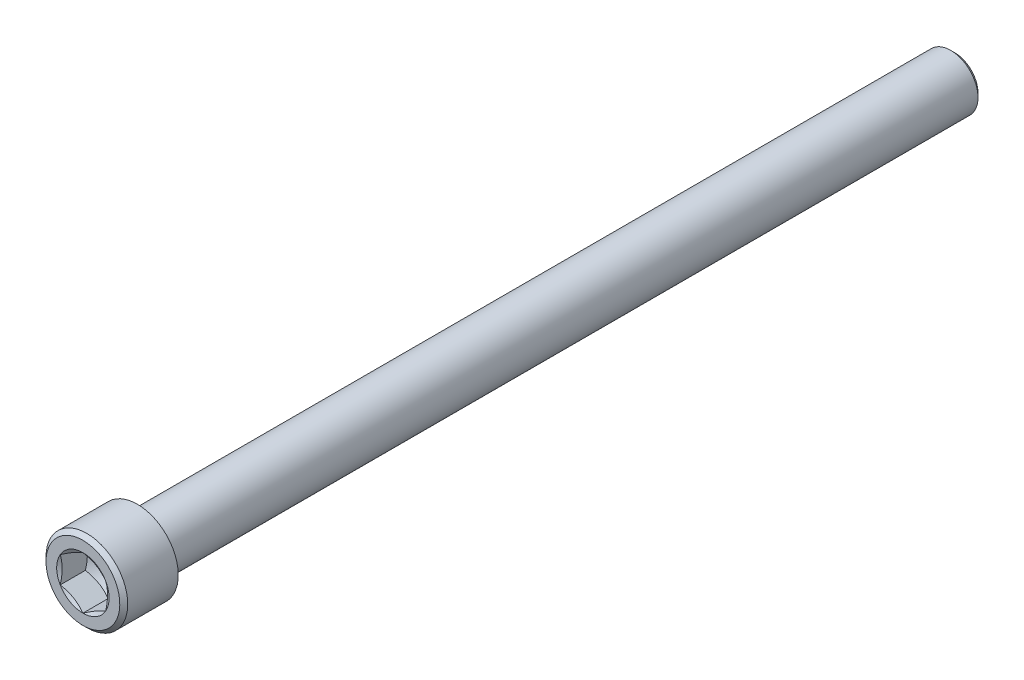
from build123d import *

# Parameters (mm, degrees)
CHAMFER1_SIZE      = 0.875
CUT_EXTRUDE1_REACH = 194.421
FILLET2_R          = 0.6


with BuildPart() as part:
    # Sketch1 → Revolve1 (revolve)
    with BuildSketch(Plane(origin=(0, 0, 0), x_dir=(0, 0, -1), z_dir=(1, 0, 0))):
        Polygon((0, 9), (-12, 9), (-12, 0), (180, 0), (180, 6), (0, 6), align=None)
    revolve(axis=Axis((0, 0, 12), (0, 0, -1)))

    # Sketch7 → Cut-Revolve2 (revolve, cut)
    with BuildSketch(Plane(origin=(0, 0, 0), x_dir=(0, 0, -1), z_dir=(1, 0, 0))):
        Polygon((-12, 0), (-12, 5), (-6, 5), (-3.113248654, 0), align=None)
    revolve(axis=Axis((0, 0, 12), (0, 0, -1)), mode=Mode.SUBTRACT)

    # Chamfer1
    chamfer1_edges = [part.edges().sort_by_distance(p)[0] for p in [
        (0, -6, -180),
        (0, -9, 12),
    ]]
    chamfer(chamfer1_edges, length=CHAMFER1_SIZE)

    # Cut-Extrude1: up to this cone (the profile starts inside it)
    cut_extrude1_end = Plane(origin=(0, 0, 12), z_dir=(0, 0, 1)).offset(-8.886750346) * Cone(1.732e-06, 379.665634345, 219.200055191, align=(Align.CENTER, Align.CENTER, Align.MIN), mode=Mode.PRIVATE)
    # Sketch8 → Cut-Extrude1 (cut, up to the surface)
    with BuildSketch(Plane.XY.offset(12), mode=Mode.PRIVATE) as cut_extrude1_sk1:
        Polygon((0, 5.773502692), (-5, 2.886751346), (-5, -2.886751346), (0, -5.773502692), (5, -2.886751346), (5, 2.886751346), align=None)
    cut_extrude1_tool1 = extrude(cut_extrude1_sk1.sketch, amount=-CUT_EXTRUDE1_REACH, mode=Mode.PRIVATE) & cut_extrude1_end
    add(cut_extrude1_tool1.solids().sort_by_distance((0, 0, 12))[0], mode=Mode.SUBTRACT)

    # Sketch9 → Cut-Revolve3 (revolve, cut)
    with BuildSketch(Plane(origin=(0, 0, 0), x_dir=(0, 0, -1), z_dir=(1, 0, 0))):
        Polygon((-12.5, 6.639528096), (-12.5, 5), (-11.553418013, 5), align=None)
    revolve(axis=Axis((0, 0, 12), (0, 0, -1)), mode=Mode.SUBTRACT)

    # Fillet2
    fillet2_edges = [part.edges().sort_by_distance(p)[0] for p in [
        (0, -6, 0),
    ]]
    fillet(fillet2_edges, radius=FILLET2_R)


solid = part.part
